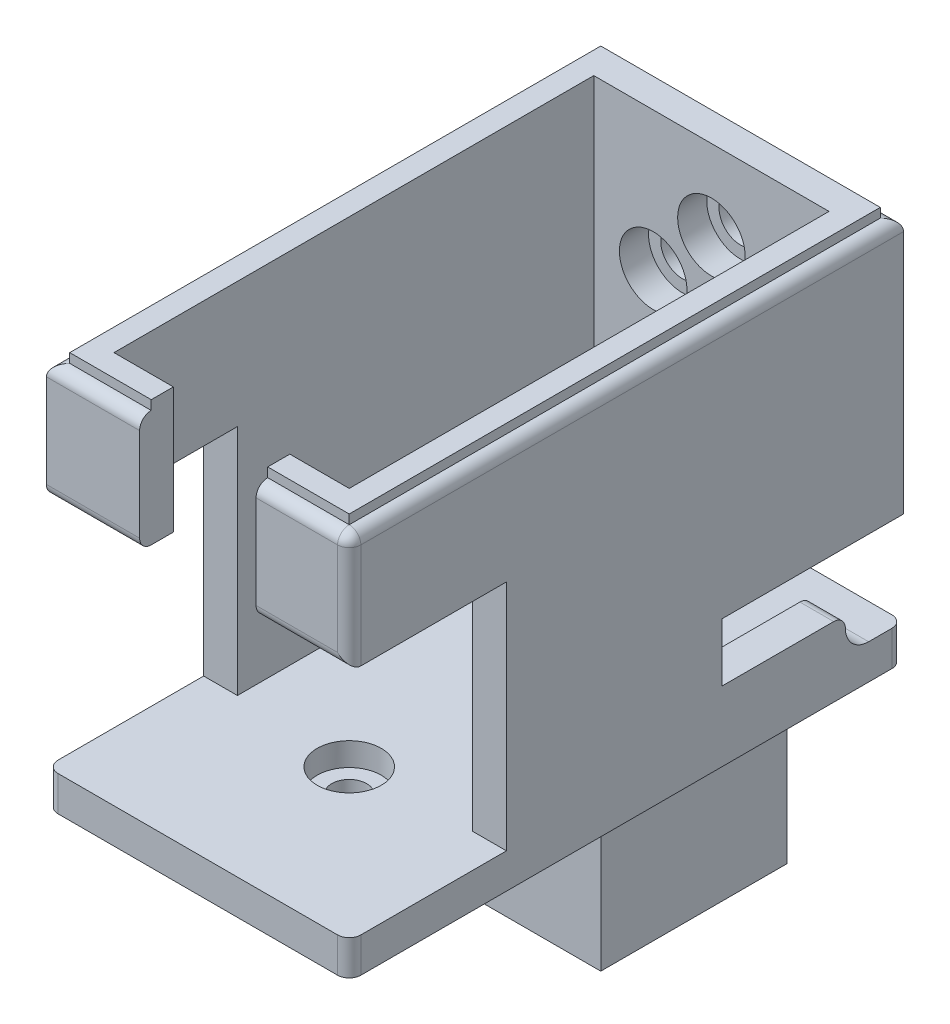
from build123d import *

# Parameters (mm, degrees)
BOSS_EXTRUDE1_DEPTH       = 10
SKETCH2_W                 = 20
SKETCH2_H                 = 17
BOSS_EXTRUDE2_DEPTH       = 3
SKETCH3_W                 = 26
SKETCH3_H                 = 47
BOSS_EXTRUDE3_DEPTH       = 3
SKETCH5_R                 = 8
SKETCH5_W                 = 16
SKETCH5_H                 = 4
CUT_EXTRUDE1_DEPTH        = 41.264748851
BOSS_EXTRUDE4_DEPTH       = 26
SKETCH7_W                 = 20
SKETCH7_H                 = 10.5
CUT_EXTRUDE2_DEPTH        = 10
SKETCH9_W                 = 8
SKETCH9_H                 = 6
CUT_EXTRUDE3_DEPTH        = 10
SKETCH10_W                = 30
SKETCH10_H                = 30
BOSS_EXTRUDE5_DEPTH       = 3
SKETCH11_R                = 1.75
CUT_EXTRUDE4_DEPTH        = 5
BOSS_EXTRUDE6_START       = 3
SKETCH12_W                = 26
SKETCH12_H                = 47
SKETCH12_R                = 8
BOSS_EXTRUDE6_DEPTH       = 3
CUT_EXTRUDE5_START        = -3
SKETCH14_R                = 8
SKETCH14_W                = 16
SKETCH14_H                = 4
CUT_EXTRUDE5_DEPTH        = 3
CUT_EXTRUDE7_DEPTH        = 49.674942219
CUT_EXTRUDE7_DEPTH_BACK   = 49.674942219
BOSS_EXTRUDE7_DEPTH       = 10.7
SKETCH18_W                = 15
SKETCH18_H                = 5
CUT_EXTRUDE8_DEPTH        = 10
SKETCH21_R                = 1.85
CUT_EXTRUDE9_DEPTH        = 5
SKETCH22_R                = 2.9
CUT_EXTRUDE10_DEPTH       = 2.6
BOSS_EXTRUDE11_OUTLINE_R  = 1.85
BOSS_EXTRUDE11_DEPTH      = 0.6
SKETCH24_R                = 1.85
BOSS_EXTRUDE12_DEPTH      = 4
SKETCH25_W                = 7
SKETCH25_H                = 3
CUT_EXTRUDE11_DEPTH       = 5
SKETCH26_W                = 20.2
SKETCH26_H                = 41.2
CUT_EXTRUDE12_DEPTH       = 30
SKETCH27_W                = 0.1
SKETCH27_H                = 3
CUT_EXTRUDE13_DEPTH       = 55.440426156
SKETCH28_R                = 8
CUT_EXTRUDE14_DEPTH       = 46.250524859
SKETCH29_W                = 2.9
SKETCH29_H                = 3
CUT_EXTRUDE15_DEPTH       = 5
FILLET1_R                 = 2
FILLET2_R                 = 2
FILLET3_R                 = 1
BOSS_EXTRUDE13_START      = -5
SKETCH35_R                = 8
SKETCH35_R_2              = 2.5
BOSS_EXTRUDE13_DEPTH      = 5
BOSS_EXTRUDE14_DEPTH      = 0.8
SKETCH38_R                = 2.55
SKETCH38_R_2              = 2.5
CUT_EXTRUDE16_DEPTH       = 2
SKETCH39_R                = 2.55
SKETCH39_R_2              = 1.25
BOSS_EXTRUDE15_DEPTH      = 1
SKETCH40_R                = 8
SKETCH40_R_2              = 6.5
CUT_EXTRUDE17_DEPTH       = 4
BOSS_EXTRUDE16_DEPTH      = 15
BOSS_EXTRUDE16_DEPTH_BACK = 3
SKETCH41_W                = 16
SKETCH41_H                = 16
FILLET4_R                 = 5
FILLET5_R                 = 3
SKETCH42_W                = 4
SKETCH42_H                = 15
CUT_EXTRUDE18_DEPTH       = 52.515628697
SKETCH43_R                = 1.5
CUT_EXTRUDE19_DEPTH       = 44.5
SKETCH44_R                = 2.75
CUT_EXTRUDE20_DEPTH       = 2


# Read off the part's stored shape, not the designer's step: Boss-Extrude11
with BuildPart() as part:
    # Sketch1 → Boss-Extrude1 (new body)
    with BuildSketch(Plane(origin=(0, 0, 0), x_dir=(1, 0, 0), z_dir=(0, 1, 0))):
        Polygon((5, -23.5), (13, -23.5), (13, 23.5), (-13, 23.5), (-13, -23.5), (-5, -23.5), (-5, -20.5), (-10, -20.5), (-10, 20.5), (10, 20.5), (10, -20.5), (5, -20.5), align=None)
    extrude(amount=BOSS_EXTRUDE1_DEPTH)

    # Sketch2 → Boss-Extrude2 (add)
    with BuildSketch(Plane(origin=(13, 0, 0), x_dir=(0, 0, -1), z_dir=(1, 0, 0))):
        with Locations((0, -8.5)):
            Rectangle(SKETCH2_W, SKETCH2_H)
    boss_extrude2 = extrude(amount=-BOSS_EXTRUDE2_DEPTH)

    # Mirror1: Boss-Extrude2 across plane
    add(boss_extrude2.mirror(Plane(origin=(0, 0, 0), x_dir=(0, 0, 1), z_dir=(1, 0, 0))))

    # Sketch3 → Boss-Extrude3 (add)
    with BuildSketch(Plane.XZ.offset(17)):
        Rectangle(SKETCH3_W, SKETCH3_H)
    extrude(amount=BOSS_EXTRUDE3_DEPTH)

    # Sketch5 → Cut-Extrude1 (cut, through all)
    with BuildSketch(Plane.XZ.offset(20)):
        with Locations(Location((0, 10.5, 0), (0, 0, 270))):
            Circle(SKETCH5_R)
        with Locations((0, -6.5)):
            Rectangle(SKETCH5_W, SKETCH5_H)
        with Locations((0, -14.5)):
            Rectangle(SKETCH5_W, SKETCH5_H)
    extrude(amount=-CUT_EXTRUDE1_DEPTH, mode=Mode.SUBTRACT)

    # Sketch6 → Boss-Extrude4 (add)
    with BuildSketch(Plane(origin=(13, 0, 0), x_dir=(0, 0, -1), z_dir=(1, 0, 0))):
        Polygon((29.5, 4.35), (23.5, 4.35), (23.5, 0), (23.5, -3.65), (29.5, -3.65), align=None)
        Polygon((23.5, -3.65), (23.5, 0), (10, 0), (10, -9.3), (23.5, -9.3), align=None)
    extrude(amount=-BOSS_EXTRUDE4_DEPTH)

    # Sketch7 → Cut-Extrude2 (cut)
    with BuildSketch(Plane(origin=(0, 0, 0), x_dir=(1, 0, 0), z_dir=(0, 1, 0))):
        with Locations((0, 15.25)):
            Rectangle(SKETCH7_W, SKETCH7_H)
    extrude(amount=-CUT_EXTRUDE2_DEPTH, mode=Mode.SUBTRACT)

    # Sketch9 → Cut-Extrude3 (cut)
    with BuildSketch(Plane(origin=(0, 4.35, 0), x_dir=(1, 0, 0), z_dir=(0, 1, 0))):
        with Locations((-9, 26.5)):
            Rectangle(SKETCH9_W, SKETCH9_H)
        with Locations((9, 26.5)):
            Rectangle(SKETCH9_W, SKETCH9_H)
    extrude(amount=-CUT_EXTRUDE3_DEPTH, mode=Mode.SUBTRACT)

    # Sketch10 → Boss-Extrude5 (add)
    with BuildSketch(Plane(origin=(0, 0, -29.5), x_dir=(-1, 0, 0), z_dir=(0, 0, -1))):
        Rectangle(SKETCH10_W, SKETCH10_H)
    extrude(amount=BOSS_EXTRUDE5_DEPTH)

    # Sketch11 → Cut-Extrude4 (cut)
    with BuildSketch(Plane(origin=(0, 0, -32.5), x_dir=(-1, 0, 0), z_dir=(0, 0, -1))):
        with Locations((0, 10)):
            Circle(SKETCH11_R)
        with Locations((10, 0)):
            Circle(SKETCH11_R)
        with Locations((0, -10)):
            Circle(SKETCH11_R)
        with Locations((-10, 0)):
            Circle(SKETCH11_R)
    extrude(amount=-CUT_EXTRUDE4_DEPTH, mode=Mode.SUBTRACT)

    # Sketch12 → Boss-Extrude6 (add)
    with BuildSketch(Plane.XZ.offset(20).offset(BOSS_EXTRUDE6_START)):
        Rectangle(SKETCH12_W, SKETCH12_H)
        with Locations(Location((0, 10.5, 0), (0, 0, 270))):
            Circle(SKETCH12_R, mode=Mode.SUBTRACT)
    extrude(amount=-BOSS_EXTRUDE6_DEPTH)

    # Sketch14 → Cut-Extrude5 (cut)
    with BuildSketch(Plane(origin=(0, -17, 0), x_dir=(1, 0, 0), z_dir=(0, 1, 0)).offset(CUT_EXTRUDE5_START)):
        Polygon((13, -23.5), (13, -10), (10, -10), (10, 10), (13, 10), (13, 23.5), (-13, 23.5), (-13, 10), (-10, 10), (-10, -10), (-13, -10), (-13, -23.5), align=None)
        with Locations(Location((0, -10.5, 0), (0, 0, 90))):
            Circle(SKETCH14_R, mode=Mode.SUBTRACT)
        with Locations((0, 6.5)):
            Rectangle(SKETCH14_W, SKETCH14_H, mode=Mode.SUBTRACT)
        with Locations((0, 14.5)):
            Rectangle(SKETCH14_W, SKETCH14_H, mode=Mode.SUBTRACT)
    extrude(amount=CUT_EXTRUDE5_DEPTH, mode=Mode.SUBTRACT)

    # Sketch15 → Cut-Extrude7 (cut, two sides: drawn at the far end of the back side and taken through both)
    with BuildSketch(Plane(origin=(13, 0, 0), x_dir=(0, 0, -1), z_dir=(1, 0, 0)).offset(-CUT_EXTRUDE7_DEPTH_BACK)):
        Polygon((23.5, -9.3), (23.5, -15.243835525), (32.5, -15.243835525), (32.5, 15), (23.5, 15), (23.5, 10), align=None)
    extrude(amount=CUT_EXTRUDE7_DEPTH + CUT_EXTRUDE7_DEPTH_BACK, mode=Mode.SUBTRACT)

    # Sketch16 → Boss-Extrude7 (add)
    with BuildSketch(Plane.XZ.offset(9.3)):
        Polygon((10, -10), (10, -20.5), (-10, -20.5), (-10, -10), (-13, -10), (-13, -23.5), (13, -23.5), (13, -10), align=None)
    extrude(amount=BOSS_EXTRUDE7_DEPTH)

    # Sketch18 → Cut-Extrude8 (cut)
    with BuildSketch(Plane(origin=(13, 0, 0), x_dir=(0, 0, -1), z_dir=(1, 0, 0))):
        with Locations((16, -14.5)):
            Rectangle(SKETCH18_W, SKETCH18_H)
    cut_extrude8 = extrude(amount=-CUT_EXTRUDE8_DEPTH, mode=Mode.SUBTRACT)

    # Mirror2: Cut-Extrude8 across plane
    add(cut_extrude8.mirror(Plane(origin=(0, 0, 0), x_dir=(0, 0, 1), z_dir=(1, 0, 0))), mode=Mode.SUBTRACT)

    # Sketch21 → Cut-Extrude9 (cut)
    with BuildSketch(Plane(origin=(0, 0, -23.5), x_dir=(-1, 0, 0), z_dir=(0, 0, -1))):
        with Locations((-5, -1.15)):
            Circle(SKETCH21_R)
        with Locations((0, 3.85)):
            Circle(SKETCH21_R)
        with Locations((5, -1.15)):
            Circle(SKETCH21_R)
        with Locations((0, -6.15)):
            Circle(SKETCH21_R)
    extrude(amount=-CUT_EXTRUDE9_DEPTH, mode=Mode.SUBTRACT)

    # Sketch22 → Cut-Extrude10 (cut)
    with BuildSketch(Plane.XY.offset(-20.5)):
        with Locations((0, 3.85)):
            Circle(SKETCH22_R)
        with Locations((5, -1.15)):
            Circle(SKETCH22_R)
        with Locations((0, -6.15)):
            Circle(SKETCH22_R)
        with Locations((-5, -1.15)):
            Circle(SKETCH22_R)
    extrude(amount=-CUT_EXTRUDE10_DEPTH, mode=Mode.SUBTRACT)

    # Boss-Extrude11 outline → Boss-Extrude11 (add)
    with BuildSketch(Plane(origin=(0, 0, -23.5), x_dir=(-1, 0, 0), z_dir=(0, 0, -1))):
        Polygon((-13, -12), (-3, -12), (-3, -17), (-13, -17), (-13, -23), (13, -23), (13, -17), (3, -17), (3, -12), (13, -12), (13, 10), (-13, 10), align=None)
        with Locations((-5, -1.15)):
            Circle(BOSS_EXTRUDE11_OUTLINE_R, mode=Mode.SUBTRACT)
        with Locations((0, -6.15)):
            Circle(BOSS_EXTRUDE11_OUTLINE_R, mode=Mode.SUBTRACT)
        with Locations((5, -1.15)):
            Circle(BOSS_EXTRUDE11_OUTLINE_R, mode=Mode.SUBTRACT)
        with Locations((0, 3.85)):
            Circle(BOSS_EXTRUDE11_OUTLINE_R, mode=Mode.SUBTRACT)
    extrude(amount=BOSS_EXTRUDE11_DEPTH)

    # Sketch24 → Boss-Extrude12 (add)
    with BuildSketch(Plane(origin=(0, 0, -24.1), x_dir=(-1, 0, 0), z_dir=(0, 0, -1))):
        with BuildLine():
            ThreePointArc((-7.5, 3.35), (-6.621320344, 5.471320344), (-4.5, 6.35))
            Line((-4.5, 6.35), (4.5, 6.35))
            ThreePointArc((4.5, 6.35), (6.621320344, 5.471320344), (7.5, 3.35))
            Line((7.5, 3.35), (7.5, -5.65))
            ThreePointArc((7.5, -5.65), (6.621320344, -7.771320344), (4.5, -8.65))
            Line((4.5, -8.65), (-4.5, -8.65))
            ThreePointArc((-4.5, -8.65), (-6.621320344, -7.771320344), (-7.5, -5.65))
            Line((-7.5, -5.65), (-7.5, 3.35))
        make_face()
        with Locations((0, -6.15)):
            Circle(SKETCH24_R, mode=Mode.SUBTRACT)
        with Locations((5, -1.15)):
            Circle(SKETCH24_R, mode=Mode.SUBTRACT)
        with Locations((-5, -1.15)):
            Circle(SKETCH24_R, mode=Mode.SUBTRACT)
        with Locations((0, 3.85)):
            Circle(SKETCH24_R, mode=Mode.SUBTRACT)
    extrude(amount=BOSS_EXTRUDE12_DEPTH)

    # Sketch25 → Cut-Extrude11 (cut)
    with BuildSketch(Plane(origin=(0, 0, -24.1), x_dir=(-1, 0, 0), z_dir=(0, 0, -1))):
        with Locations((-6.5, -18.5)):
            Rectangle(SKETCH25_W, SKETCH25_H)
        with Locations((6.5, -18.5)):
            Rectangle(SKETCH25_W, SKETCH25_H)
    extrude(amount=-CUT_EXTRUDE11_DEPTH, mode=Mode.SUBTRACT)

    # Sketch26 → Cut-Extrude12 (cut)
    with BuildSketch(Plane(origin=(0, 10, 0), x_dir=(1, 0, 0), z_dir=(0, 1, 0))):
        Rectangle(SKETCH26_W, SKETCH26_H)
    extrude(amount=-CUT_EXTRUDE12_DEPTH, mode=Mode.SUBTRACT)

    # Sketch27 → Cut-Extrude13 (cut, through all)
    with BuildSketch(Plane(origin=(0, 0, -24.1), x_dir=(-1, 0, 0), z_dir=(0, 0, -1))):
        with Locations((-10.05, -18.5)):
            Rectangle(SKETCH27_W, SKETCH27_H)
        with Locations((10.05, -18.5)):
            Rectangle(SKETCH27_W, SKETCH27_H)
    extrude(amount=-CUT_EXTRUDE13_DEPTH, mode=Mode.SUBTRACT)

    # Sketch28 → Cut-Extrude14 (cut, through all)
    with BuildSketch(Plane.XZ.offset(23)):
        with Locations(Location((0, -11.1, 0), (0, 0, 270))):
            Circle(SKETCH28_R)
    extrude(amount=-CUT_EXTRUDE14_DEPTH, mode=Mode.SUBTRACT)

    # Sketch29 → Cut-Extrude15 (cut)
    with BuildSketch(Plane(origin=(0, 0, -24.1), x_dir=(-1, 0, 0), z_dir=(0, 0, -1))):
        with Locations((-11.55, -18.5)):
            Rectangle(SKETCH29_W, SKETCH29_H)
        with Locations((11.55, -18.5)):
            Rectangle(SKETCH29_W, SKETCH29_H)
    extrude(amount=-CUT_EXTRUDE15_DEPTH, mode=Mode.SUBTRACT)

    # Fillet1
    fillet1_edges = [part.edges().sort_by_distance(p)[0] for p in [
        (-3, -20, -22.35),
        (3, -20, -22.35),
    ]]
    fillet(fillet1_edges, radius=FILLET1_R)

    # Fillet2
    fillet2_edges = [part.edges().sort_by_distance(p)[0] for p in [
        (11.55, -20, -19.1),
        (-11.55, -20, -19.1),
    ]]
    fillet(fillet2_edges, radius=FILLET2_R)

    # Fillet3
    fillet3_edges = [part.edges().sort_by_distance(p)[0] for p in [
        (11.55, -17, -19.1),
        (-11.55, -17, -19.1),
        (-9, 10, 23.5),
        (-13, 10, -0.3),
        (0, 10, -24.1),
        (13, 10, -0.3),
        (9, 10, 23.5),
        (13, 5, 23.5),
        (9, 0, 23.5),
        (-9, 0, 23.5),
        (13, -21.5, -24.1),
        (-13, -21.5, -24.1),
        (-13, -21.5, 23.5),
        (13, -21.5, 23.5),
    ]]
    fillet(fillet3_edges, radius=FILLET3_R - 0.0001)  # a hair under: the kernel refuses the full size

    # Sketch35 → Boss-Extrude13 (add)
    with BuildSketch(Plane(origin=(0, -20, 0), x_dir=(1, 0, 0), z_dir=(0, 1, 0)).offset(BOSS_EXTRUDE13_START)):
        with Locations(Location((0, -10.5, 0), (0, 0, 270))):
            Circle(SKETCH35_R)
        with Locations(Location((0, -10.5, 0), (0, 0, 270))):
            Circle(SKETCH35_R_2, mode=Mode.SUBTRACT)
    extrude(amount=BOSS_EXTRUDE13_DEPTH)

    # Sketch36 → Boss-Extrude14 (add)
    with BuildSketch(Plane(origin=(0, 10, 0), x_dir=(1, 0, 0), z_dir=(0, 1, 0))):
        Polygon((12, 23.1), (-12, 23.1), (-12, -22.5), (-5, -22.5), (-5, -20.6), (-10.1, -20.6), (-10.1, 20.6), (10.1, 20.6), (10.1, -20.6), (5, -20.6), (5, -22.5), (12, -22.5), align=None)
    extrude(amount=BOSS_EXTRUDE14_DEPTH)

    # Sketch38 → Cut-Extrude16 (cut)
    with BuildSketch(Plane.XZ.offset(25)):
        with Locations(Location((0, 10.5, 0), (0, 0, 270))):
            Circle(SKETCH38_R)
        with Locations(Location((0, 10.5, 0), (0, 0, 90))):
            Circle(SKETCH38_R_2, mode=Mode.SUBTRACT)
    extrude(amount=-CUT_EXTRUDE16_DEPTH, mode=Mode.SUBTRACT)

    # Sketch39 → Boss-Extrude15 (add)
    with BuildSketch(Plane.XZ.offset(23)):
        with Locations(Location((0, 10.5, 0), (0, 0, 270))):
            Circle(SKETCH39_R)
        with Locations(Location((0, 10.5, 0), (0, 0, 270))):
            Circle(SKETCH39_R_2, mode=Mode.SUBTRACT)
    extrude(amount=-BOSS_EXTRUDE15_DEPTH)

    # Sketch40 → Cut-Extrude17 (cut)
    with BuildSketch(Plane.XZ.offset(25)):
        with Locations(Location((0, 10.5, 0), (0, 0, 270))):
            Circle(SKETCH40_R)
        with Locations(Location((0, 10.5, 0), (0, 0, 270))):
            Circle(SKETCH40_R_2, mode=Mode.SUBTRACT)
    extrude(amount=-CUT_EXTRUDE17_DEPTH, mode=Mode.SUBTRACT)

    # Sketch41 → Boss-Extrude16 (add, two sides: drawn at the far end of the back side and taken through both)
    with BuildSketch(Plane.XZ.offset(23).offset(-BOSS_EXTRUDE16_DEPTH_BACK)):
        with Locations((0, -11.1)):
            Rectangle(SKETCH41_W, SKETCH41_H)
    extrude(amount=BOSS_EXTRUDE16_DEPTH + BOSS_EXTRUDE16_DEPTH_BACK)

    # Fillet4
    fillet4_edges = [part.edges().sort_by_distance(p)[0] for p in [
        (0, -23, -3.1),
    ]]
    fillet(fillet4_edges, radius=FILLET4_R)

    # Fillet5
    fillet5_edges = [part.edges().sort_by_distance(p)[0] for p in [
        (0, -23, -19.1),
    ]]
    fillet(fillet5_edges, radius=FILLET5_R)

    # Sketch42 → Cut-Extrude18 (cut, through all)
    with BuildSketch(Plane(origin=(7.5, 0, 0), x_dir=(0, 0, -1), z_dir=(1, 0, 0))):
        with Locations((26.1, -1.15)):
            Rectangle(SKETCH42_W, SKETCH42_H)
    extrude(amount=-CUT_EXTRUDE18_DEPTH, mode=Mode.SUBTRACT)

    # Sketch43 → Cut-Extrude19 (cut, through all)
    with BuildSketch(Plane.XZ.offset(23)):
        with Locations(Location((0, 10.5, 0), (0, 0, 270))):
            Circle(SKETCH43_R)
    extrude(amount=-CUT_EXTRUDE19_DEPTH, mode=Mode.SUBTRACT)

    # Sketch44 → Cut-Extrude20 (cut)
    with BuildSketch(Plane(origin=(0, -20, 0), x_dir=(1, 0, 0), z_dir=(0, 1, 0))):
        with Locations(Location((0, -10.5, 0), (0, 0, 270))):
            Circle(SKETCH44_R)
    extrude(amount=-CUT_EXTRUDE20_DEPTH, mode=Mode.SUBTRACT)


solid = part.part
